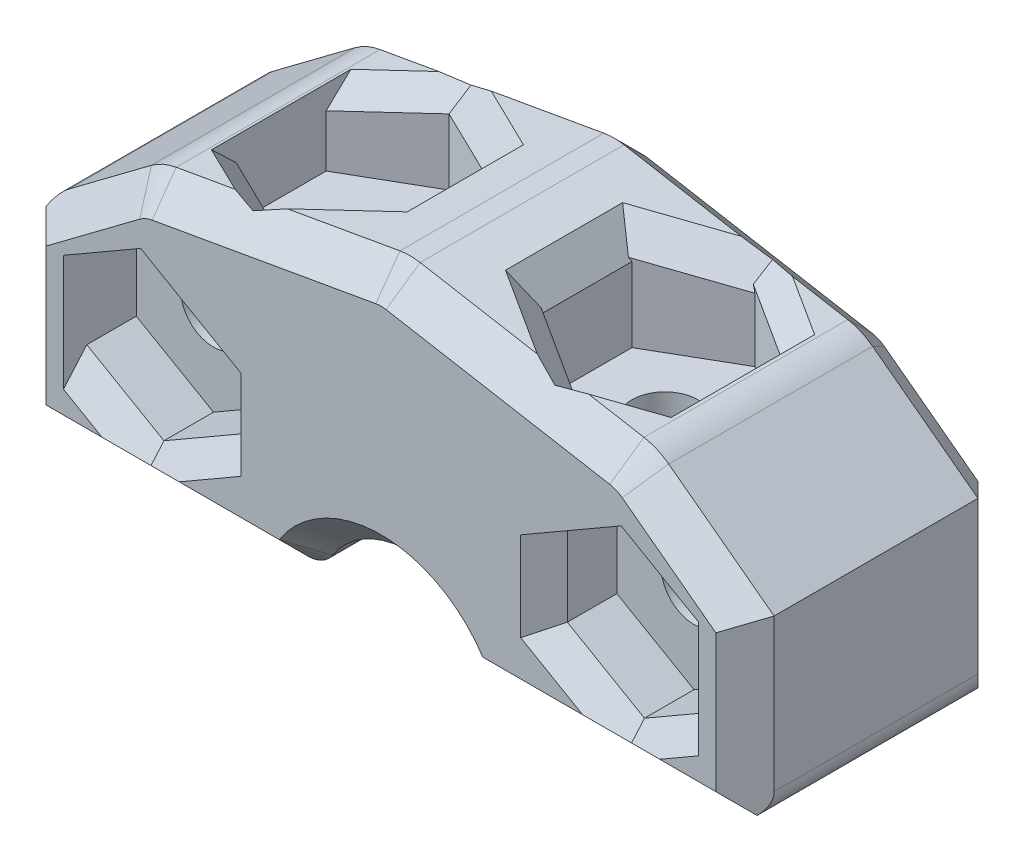
from build123d import *

# Parameters (mm, degrees)
BOSS_EXTRUDE1_DEPTH     = 9
CUT_EXTRUDE1_DEPTH      = 20.52562419
CUT_EXTRUDE1_DEPTH_BACK = 20.52562419
CHAMFER1_SIZE           = 1
CUT_EXTRUDE6_DEPTH      = 20.52562419
CUT_EXTRUDE6_DEPTH_BACK = 20.52562419
SKETCH8_W               = 25
SKETCH8_H               = 1.280441735
FILLET3_R               = 1
SKETCH4_R               = 1.125
CUT_EXTRUDE2_DEPTH      = 19.765898044
CUT_EXTRUDE3_START      = 8
CUT_EXTRUDE3_DEPTH      = 8
FILLET2_R               = 2
CHAMFER2_SIZE           = 1
SKETCH6_R               = 1.125
CUT_EXTRUDE4_DEPTH      = 20.506647196
CUT_EXTRUDE5_DEPTH      = 2.5
CHAMFER3_SIZE           = 0.8
CHAMFER3_SIZE_2         = 0.986438657
CHAMFER3_SIZE_3         = 0.879773446
CHAMFER3_SIZE_4         = 0.73861357
CHAMFER4_SIZE           = 1
CHAMFER5_SIZE           = 1


with BuildPart() as part:
    # Sketch1 → Boss-Extrude1 (new body)
    with BuildSketch(Plane.XY):
        with BuildLine():
            Line((-3.175, 0), (-12.5, 0))
            Line((-12.5, 0), (-12.5, 12))
            Line((-12.5, 12), (12.5, 12))
            Line((12.5, 12), (12.5, 0))
            Line((12.5, 0), (3.175, 0))
            ThreePointArc((3.175, 0), (0, 3.175), (-3.175, 0))
        make_face()
    extrude(amount=BOSS_EXTRUDE1_DEPTH)

    # Sketch2 → Cut-Extrude1 (cut, two sides: drawn at the far end of the back side and taken through both)
    with BuildSketch(Plane.XY.offset(9).offset(-CUT_EXTRUDE1_DEPTH_BACK)):
        Polygon((-8.5, 10.5), (0, 12), (-12.5, 12), (-12.5, 7.504439372), align=None)
        Polygon((12.5, 12), (0, 12), (8.5, 10.5), (12.5, 7.504439372), align=None)
    extrude(amount=CUT_EXTRUDE1_DEPTH + CUT_EXTRUDE1_DEPTH_BACK, mode=Mode.SUBTRACT)

    # Chamfer1
    chamfer1_edges = [part.edges().sort_by_distance(p)[0] for p in [
        (12.5, 3.752219686, 9),
        (-12.5, 3.752219686, 0),
        (-12.5, 3.752219686, 9),
        (12.5, 3.752219686, 0),
    ]]
    chamfer(chamfer1_edges, length=CHAMFER1_SIZE)

    # Sketch8 → Cut-Extrude6 (cut, two sides: drawn at the far end of the back side and taken through both)
    with BuildSketch(Plane(origin=(0, 0, 0), x_dir=(-1, 0, 0), z_dir=(0, 0, -1)).offset(-CUT_EXTRUDE6_DEPTH_BACK)):
        with Locations((0, 0.640220868)):
            Rectangle(SKETCH8_W, SKETCH8_H)
    extrude(amount=CUT_EXTRUDE6_DEPTH + CUT_EXTRUDE6_DEPTH_BACK, mode=Mode.SUBTRACT)

    # Fillet3
    fillet3_edges = [part.edges().sort_by_distance(p)[0] for p in [
        (-12.5, 1.280441735, 4.5),
        (2.905356082, 1.280441735, 4.5),
        (-2.905356082, 1.280441735, 4.5),
        (12.5, 1.280441735, 4.5),
    ]]
    fillet(fillet3_edges, radius=FILLET3_R)

    # Sketch4 → Cut-Extrude2 (cut, through all)
    with BuildSketch(Plane.XZ.offset(-1.280441735)):
        with Locations(Location((-5.25, 4.5, 0), (0, 0, 270))):
            Circle(SKETCH4_R)
        with Locations(Location((5.25, 4.5, 0), (0, 0, 270))):
            Circle(SKETCH4_R)
    extrude(amount=-CUT_EXTRUDE2_DEPTH, mode=Mode.SUBTRACT)

    # Sketch5 → Cut-Extrude3 (cut)
    with BuildSketch(Plane(origin=(0, 0, 0), x_dir=(1, 0, 0), z_dir=(0, 1, 0)).offset(CUT_EXTRUDE3_START)):
        Polygon((-5.25, -7.58882394), (-2.575, -6.04441197), (-2.575, -2.95558803), (-5.25, -1.41117606), (-7.925, -2.95558803), (-7.925, -6.04441197), align=None)
        Polygon((5.25, -7.58882394), (7.925, -6.04441197), (7.925, -2.95558803), (5.25, -1.41117606), (2.575, -2.95558803), (2.575, -6.04441197), align=None)
    extrude(amount=CUT_EXTRUDE3_DEPTH, mode=Mode.SUBTRACT)

    # Fillet2
    fillet2_edges = [part.edges().sort_by_distance(p)[0] for p in [
        (-8.5, 10.5, 4.5),
        (0, 12, 4.5),
        (8.5, 10.5, 4.5),
        (-12.5, 7.504439372, 4.5),
    ]]
    fillet(fillet2_edges, radius=FILLET2_R)

    # Chamfer2
    chamfer2_edges = [part.edges().sort_by_distance(p)[0] for p in [
        (-7.498585893, 1.280441735, 9),
        (-3.020838703, 1.401176818, 9),
        (0, 3.175, 9),
        (3.020838703, 1.401176818, 9),
        (7.498585893, 1.280441735, 9),
    ]]
    chamfer(chamfer2_edges, length=CHAMFER2_SIZE)
    # the kernel refuses this chamfer: 1 mm, written as the material it takes off along each edge
    with BuildSketch(Plane(origin=(-13.558442454, 6.711782236, 9), x_dir=(0.5992046713039103, -0.8001235771160529, 0.027495876610585623), z_dir=(0.8004262047278154, 0.5994313061436025, 0)), Plane(origin=(8.881689813, 10.214156256, 9), x_dir=(-0.59920467130391, -0.8001235771160532, 0.027495876610585623), z_dir=(0.8004262047278157, -0.5994313061436022, 0))) as chamfer2_2_piece_1:
        with BuildLine():
            Line((1.028673195, 0), (-0.056547155, 1.027117794))
            Line((-0.056547155, 1.027117794), (-0.076539593, 1.026567876))
            ThreePointArc((-0.076539593, 1.026567876), (-0.034129227, 0.51339783), (-0.019992438, -0.000549918))
            Line((-0.019992438, -0.000549918), (0.000549918, -0.019992438))
            ThreePointArc((0.000549918, -0.019992438), (0.514497665, -0.00585565), (1.029223113, -0.019992438))
            Line((1.029223113, -0.019992438), (1.028673195, 0))
        make_face()
    extrude(amount=5.842828, mode=Mode.SUBTRACT)
    with BuildSketch(Plane(origin=(-7.6828272, 8.613303847, 9), x_dir=(-0.5994313061436031, 0.8004262047278151, 0), z_dir=(-0.8004262047278151, -0.5994313061436031, 0))) as chamfer2_2_piece_2:
        with BuildLine():
            Line((0.971715729, -0.028284271), (2.028284271, 1.028284271))
            Line((2.028284271, 1.028284271), (2.048284271, 1.028284271))
            ThreePointArc((2.048284271, 1.028284271), (2.02, 0.514142136), (2.02, 0))
            Line((2.02, 0), (2, -0.02))
            ThreePointArc((2, -0.02), (1.485857864, -0.02), (0.971715729, -0.048284271))
            Line((0.971715729, -0.048284271), (0.971715729, -0.028284271))
        make_face()
    revolve(axis=Axis((-7.6828272, 8.613303847, 9), (0, 0, -1)), revolution_arc=26.821198995, mode=Mode.SUBTRACT)
    with BuildSketch(Plane(origin=(-8.030397868, 10.582870964, 9), x_dir=(0.173719628613232, -0.9844112288083147, 0.027495876610585654), z_dir=(0.9847835588179369, 0.17378533390904768, 0)), Plane(origin=(0.347570668, 11.938664, 9), x_dir=(-0.17371962861323179, -0.9844112288083147, 0.027495876610585654), z_dir=(0.9847835588179369, -0.17378533390904746, 0))) as chamfer2_2_piece_3:
        with BuildLine():
            Line((1.028673195, 0), (-0.056547155, 1.027117794))
            Line((-0.056547155, 1.027117794), (-0.076539593, 1.026567876))
            ThreePointArc((-0.076539593, 1.026567876), (-0.034129227, 0.51339783), (-0.019992438, -0.000549918))
            Line((-0.019992438, -0.000549918), (0.000549918, -0.019992438))
            ThreePointArc((0.000549918, -0.019992438), (0.514497665, -0.00585565), (1.029223113, -0.019992438))
            Line((1.029223113, -0.019992438), (1.028673195, 0))
        make_face()
    extrude(amount=7.801538858, mode=Mode.SUBTRACT)
    with BuildSketch(Plane(origin=(0, 9.969096882, 9), x_dir=(-0.17378533390904846, 0.9847835588179368, 0), z_dir=(-0.9847835588179368, -0.17378533390904846, 0))) as chamfer2_2_piece_4:
        with BuildLine():
            Line((0.971715729, -0.028284271), (2.028284271, 1.028284271))
            Line((2.028284271, 1.028284271), (2.048284271, 1.028284271))
            ThreePointArc((2.048284271, 1.028284271), (2.02, 0.514142136), (2.02, 0))
            Line((2.02, 0), (2, -0.02))
            ThreePointArc((2, -0.02), (1.485857864, -0.02), (0.971715729, -0.048284271))
            Line((0.971715729, -0.048284271), (0.971715729, -0.028284271))
        make_face()
    revolve(axis=Axis((0, 9.969096882, 9), (0, 0, -1)), revolution_arc=20.015959603, mode=Mode.SUBTRACT)
    with BuildSketch(Plane(origin=(7.6828272, 8.613303847, 9), x_dir=(0.17378533390904757, 0.9847835588179368, 0), z_dir=(-0.9847835588179368, 0.17378533390904757, 0))) as chamfer2_2_piece_5:
        with BuildLine():
            Line((0.971715729, -0.028284271), (2.028284271, 1.028284271))
            Line((2.028284271, 1.028284271), (2.048284271, 1.028284271))
            ThreePointArc((2.048284271, 1.028284271), (2.02, 0.514142136), (2.02, 0))
            Line((2.02, 0), (2, -0.02))
            ThreePointArc((2, -0.02), (1.485857864, -0.02), (0.971715729, -0.048284271))
            Line((0.971715729, -0.048284271), (0.971715729, -0.028284271))
        make_face()
    revolve(axis=Axis((7.6828272, 8.613303847, 9), (0, 0, -1)), revolution_arc=26.821198995, mode=Mode.SUBTRACT)

    # Sketch6 → Cut-Extrude4 (cut, through all)
    with BuildSketch(Plane.XY.offset(9)):
        with Locations((-8.25, 5.5)):
            Circle(SKETCH6_R)
        with Locations((8.25, 5.5)):
            Circle(SKETCH6_R)
    extrude(amount=-CUT_EXTRUDE4_DEPTH, mode=Mode.SUBTRACT)

    # Sketch7 → Cut-Extrude5 (cut)
    with BuildSketch(Plane.XY.offset(9)):
        Polygon((-8.25, 2.440043573), (-5.6, 3.970021787), (-5.6, 7.029978213), (-8.25, 8.559956427), (-10.9, 7.029978213), (-10.9, 3.970021787), align=None)
        Polygon((8.25, 2.440043573), (10.9, 3.970021787), (10.9, 7.029978213), (8.25, 8.559956427), (5.6, 7.029978213), (5.6, 3.970021787), align=None)
    extrude(amount=-CUT_EXTRUDE5_DEPTH, mode=Mode.SUBTRACT)

    # Chamfer3
    # the kernel refuses this chamfer: 0.986438657, 0.879773446, 0.8, 0.73861357 mm, written as the material it takes off along each edge
    with BuildSketch(Plane(origin=(2.575, 11.545588235, 8.591948952), x_dir=(-0.9783714762369112, 0.20685563682434935, 0), z_dir=(0, 0, -1))) as chamfer3_piece_1_section:
        Polygon((CHAMFER3_SIZE * 0.999432620131, -CHAMFER3_SIZE * 0.0336814165085), (-CHAMFER3_SIZE_2 * 0.206855636874, -CHAMFER3_SIZE_2 * 0.978371476471), (0, 0), align=None)
    chamfer3_piece_1 = extrude(amount=8.183897904, mode=Mode.PRIVATE)
    chamfer3_piece_1 = split(chamfer3_piece_1, bisect_by=Plane(origin=(1.725667203, 11.250261997, 3.445950549), z_dir=(0.5000000000000002, 0, 0.8660254037844386)), keep=Keep.TOP, mode=Mode.PRIVATE)
    chamfer3_piece_1 = split(chamfer3_piece_1, bisect_by=Plane(origin=(1.725667203, 11.250261997, 5.554049451), z_dir=(0.4999999999999991, 0, -0.8660254037844392)), keep=Keep.TOP, mode=Mode.PRIVATE)
    add(chamfer3_piece_1, mode=Mode.SUBTRACT)
    with BuildSketch(Plane(origin=(-2.575, 11.545588235, 0.408051048), x_dir=(0.9806818086984711, 0.19560979036821113, 0), z_dir=(0, 0, 1))) as chamfer3_piece_2_section:
        Polygon((CHAMFER3_SIZE_2 * 0.999753434612, -CHAMFER3_SIZE_2 * 0.0222051899206), (-CHAMFER3_SIZE * 0.195609790368, -CHAMFER3_SIZE * 0.980681808698), (0, 0), align=None)
    chamfer3_piece_2 = extrude(amount=8.183897904, mode=Mode.PRIVATE)
    chamfer3_piece_2 = split(chamfer3_piece_2, bisect_by=Plane(origin=(-1.684184287, 11.325273908, 3.469900721), z_dir=(-0.49999999999999983, 0, 0.8660254037844388)), keep=Keep.TOP, mode=Mode.PRIVATE)
    chamfer3_piece_2 = split(chamfer3_piece_2, bisect_by=Plane(origin=(-1.684184287, 11.325273908, 5.530099279), z_dir=(-0.4999999999999994, 0, -0.866025403784439)), keep=Keep.TOP, mode=Mode.PRIVATE)
    add(chamfer3_piece_2, mode=Mode.SUBTRACT)
    with BuildSketch(Plane(origin=(-12.681714238, 4.998694982, 9), x_dir=(-0.49981095845564805, -0.8656979742248805, 0.02749587661058733), z_dir=(0.8660254037844388, -0.4999999999999997, 0))) as chamfer3_piece_3_section:
        Polygon((CHAMFER3_SIZE * 0.999621916911, CHAMFER3_SIZE * 0.0274958766106), (-CHAMFER3_SIZE * 0.0274958766106, CHAMFER3_SIZE * 0.999621916911), (0, 0), align=None)
    chamfer3_piece_3 = extrude(amount=7.174649207, mode=Mode.PRIVATE)
    chamfer3_piece_3 = split(chamfer3_piece_3, bisect_by=Plane(origin=(-10.9, 2.991295266, 8.727059614), z_dir=(1, 0, 0)), keep=Keep.TOP, mode=Mode.PRIVATE)
    chamfer3_piece_3 = split(chamfer3_piece_3, bisect_by=Plane(origin=(-9.09760203, 1.950680313, 8.727059614), z_dir=(-0.5000000000000011, 0.866025403784438, 0)), keep=Keep.TOP, mode=Mode.PRIVATE)
    add(chamfer3_piece_3, mode=Mode.SUBTRACT)
    with BuildSketch(Plane(origin=(-10.031714238, 1.411370378, 9), x_dir=(0.49981095845564943, -0.8656979742248796, 0.02749587661058734), z_dir=(0.866025403784438, 0.5000000000000011, 0))) as chamfer3_piece_4_section:
        Polygon((CHAMFER3_SIZE * 0.999621916911, CHAMFER3_SIZE * 0.0274958766106), (-CHAMFER3_SIZE * 0.0274958766106, CHAMFER3_SIZE * 0.999621916911), (0, 0), align=None)
    chamfer3_piece_4 = extrude(amount=7.174649207, mode=Mode.PRIVATE)
    chamfer3_piece_4 = split(chamfer3_piece_4, bisect_by=Plane(origin=(-7.40239797, 1.950680313, 8.727059614), z_dir=(0.4999999999999997, 0.8660254037844388, 0)), keep=Keep.TOP, mode=Mode.PRIVATE)
    chamfer3_piece_4 = split(chamfer3_piece_4, bisect_by=Plane(origin=(-5.6, 2.991295266, 8.727059614), z_dir=(-1, 0, 0)), keep=Keep.TOP, mode=Mode.PRIVATE)
    add(chamfer3_piece_4, mode=Mode.SUBTRACT)
    with BuildSketch(Plane(origin=(-5.6, 1.912675396, 9), x_dir=(0.9996219169112966, 3.4817853223456008e-15, 0.02749587661058736), z_dir=(0, 1, 0))) as chamfer3_piece_5_section:
        Polygon((CHAMFER3_SIZE * 0.999621916911, CHAMFER3_SIZE * 0.0274958766106), (-CHAMFER3_SIZE * 0.0274958766106, CHAMFER3_SIZE * 0.999621916911), (0, 0), align=None)
    chamfer3_piece_5 = extrude(amount=7.174649207, mode=Mode.PRIVATE)
    chamfer3_piece_5 = split(chamfer3_piece_5, bisect_by=Plane(origin=(-4.75239797, 6.540614953, 8.727059614), z_dir=(-0.5000000000000006, -0.8660254037844384, 0)), keep=Keep.TOP, mode=Mode.PRIVATE)
    chamfer3_piece_5 = split(chamfer3_piece_5, bisect_by=Plane(origin=(-4.75239797, 4.459385047, 8.727059614), z_dir=(-0.5000000000000011, 0.866025403784438, 0)), keep=Keep.TOP, mode=Mode.PRIVATE)
    add(chamfer3_piece_5, mode=Mode.SUBTRACT)
    with BuildSketch(Plane(origin=(3.818285762, 4.998694982, 9), x_dir=(-0.49981095845564866, -0.8656979742248802, 0.027495876610587364), z_dir=(0.8660254037844386, -0.5000000000000003, 0))) as chamfer3_piece_6_section:
        Polygon((CHAMFER3_SIZE * 0.999621916911, CHAMFER3_SIZE * 0.0274958766106), (-CHAMFER3_SIZE * 0.0274958766106, CHAMFER3_SIZE * 0.999621916911), (0, 0), align=None)
    chamfer3_piece_6 = extrude(amount=7.174649207, mode=Mode.PRIVATE)
    chamfer3_piece_6 = split(chamfer3_piece_6, bisect_by=Plane(origin=(5.6, 2.991295266, 8.727059614), z_dir=(1, 0, 0)), keep=Keep.TOP, mode=Mode.PRIVATE)
    chamfer3_piece_6 = split(chamfer3_piece_6, bisect_by=Plane(origin=(7.40239797, 1.950680313, 8.727059614), z_dir=(-0.5000000000000017, 0.8660254037844377, 0)), keep=Keep.TOP, mode=Mode.PRIVATE)
    add(chamfer3_piece_6, mode=Mode.SUBTRACT)
    with BuildSketch(Plane(origin=(6.468285762, 1.411370378, 9), x_dir=(0.49981095845565005, -0.8656979742248794, 0.02749587661058733), z_dir=(0.8660254037844377, 0.5000000000000017, 0))) as chamfer3_piece_7_section:
        Polygon((CHAMFER3_SIZE * 0.999621916911, CHAMFER3_SIZE * 0.0274958766106), (-CHAMFER3_SIZE * 0.0274958766106, CHAMFER3_SIZE * 0.999621916911), (0, 0), align=None)
    chamfer3_piece_7 = extrude(amount=7.174649207, mode=Mode.PRIVATE)
    chamfer3_piece_7 = split(chamfer3_piece_7, bisect_by=Plane(origin=(9.09760203, 1.950680313, 8.727059614), z_dir=(0.5000000000000003, 0.8660254037844387, 0)), keep=Keep.TOP, mode=Mode.PRIVATE)
    chamfer3_piece_7 = split(chamfer3_piece_7, bisect_by=Plane(origin=(10.9, 2.991295266, 8.727059614), z_dir=(-1, 0, 0)), keep=Keep.TOP, mode=Mode.PRIVATE)
    add(chamfer3_piece_7, mode=Mode.SUBTRACT)
    with BuildSketch(Plane(origin=(5.6, 9.087324604, 9), x_dir=(-0.9996219169112966, 0, 0.02749587661058736), z_dir=(0, -1, 0))) as chamfer3_piece_8_section:
        Polygon((CHAMFER3_SIZE * 0.999621916911, CHAMFER3_SIZE * 0.0274958766106), (-CHAMFER3_SIZE * 0.0274958766106, CHAMFER3_SIZE * 0.999621916911), (0, 0), align=None)
    chamfer3_piece_8 = extrude(amount=7.174649207, mode=Mode.PRIVATE)
    chamfer3_piece_8 = split(chamfer3_piece_8, bisect_by=Plane(origin=(4.75239797, 4.459385047, 8.727059614), z_dir=(0.5000000000000003, 0.8660254037844387, 0)), keep=Keep.TOP, mode=Mode.PRIVATE)
    chamfer3_piece_8 = split(chamfer3_piece_8, bisect_by=Plane(origin=(4.75239797, 6.540614953, 8.727059614), z_dir=(0.5000000000000002, -0.8660254037844386, 0)), keep=Keep.TOP, mode=Mode.PRIVATE)
    add(chamfer3_piece_8, mode=Mode.SUBTRACT)
    with BuildSketch(Plane(origin=(-12.681714238, 4.998694982, 9), x_dir=(-0.49981095845564805, -0.8656979742248805, 0.02749587661058733), z_dir=(0.8660254037844388, -0.4999999999999997, 0))) as chamfer3_piece_9a_section:
        Polygon((CHAMFER3_SIZE * 0.999621916911, CHAMFER3_SIZE * 0.0274958766106), (-CHAMFER3_SIZE * 0.0274958766106, CHAMFER3_SIZE * 0.999621916911), (0, 0), align=None)
    chamfer3_piece_9a = extrude(amount=7.174649207, mode=Mode.PRIVATE)
    chamfer3_piece_9a = split(chamfer3_piece_9a, bisect_by=Plane(origin=(-8.044718585, 2.558562853, 8.74184205), z_dir=(0.5000000000000011, -0.866025403784438, 0)), keep=Keep.TOP, mode=Mode.PRIVATE)
    with BuildSketch(Plane(origin=(-10.031714238, 1.411370378, 9), x_dir=(0.49981095845564943, -0.8656979742248796, 0.02749587661058734), z_dir=(0.866025403784438, 0.5000000000000011, 0))) as chamfer3_piece_9b_section:
        Polygon((CHAMFER3_SIZE * 0.999621916911, CHAMFER3_SIZE * 0.0274958766106), (-CHAMFER3_SIZE * 0.0274958766106, CHAMFER3_SIZE * 0.999621916911), (0, 0), align=None)
    chamfer3_piece_9b = extrude(amount=7.174649207, mode=Mode.PRIVATE)
    chamfer3_piece_9b = split(chamfer3_piece_9b, bisect_by=Plane(origin=(-8.455281415, 2.558562853, 8.74184205), z_dir=(-0.4999999999999997, -0.8660254037844388, 0)), keep=Keep.TOP, mode=Mode.PRIVATE)
    chamfer3_piece_9 = chamfer3_piece_9a & chamfer3_piece_9b
    add(chamfer3_piece_9, mode=Mode.SUBTRACT)
    with BuildSketch(Plane(origin=(-5.6, 1.912675396, 9), x_dir=(0.9996219169112966, 3.4817853223456008e-15, 0.02749587661058736), z_dir=(0, 1, 0))) as chamfer3_piece_10a_section:
        Polygon((CHAMFER3_SIZE * 0.999621916911, CHAMFER3_SIZE * 0.0274958766106), (-CHAMFER3_SIZE * 0.0274958766106, CHAMFER3_SIZE * 0.999621916911), (0, 0), align=None)
    chamfer3_piece_10a = extrude(amount=7.174649207, mode=Mode.PRIVATE)
    chamfer3_piece_10a = split(chamfer3_piece_10a, bisect_by=Plane(origin=(-5.805281415, 3.851502507, 8.74184205), z_dir=(0.5000000000000011, -0.866025403784438, 0)), keep=Keep.TOP, mode=Mode.PRIVATE)
    with BuildSketch(Plane(origin=(-10.031714238, 1.411370378, 9), x_dir=(0.49981095845564943, -0.8656979742248796, 0.02749587661058734), z_dir=(0.866025403784438, 0.5000000000000011, 0))) as chamfer3_piece_10b_section:
        Polygon((CHAMFER3_SIZE * 0.999621916911, CHAMFER3_SIZE * 0.0274958766106), (-CHAMFER3_SIZE * 0.0274958766106, CHAMFER3_SIZE * 0.999621916911), (0, 0), align=None)
    chamfer3_piece_10b = extrude(amount=7.174649207, mode=Mode.PRIVATE)
    chamfer3_piece_10b = split(chamfer3_piece_10b, bisect_by=Plane(origin=(-5.6, 4.207060347, 8.74184205), z_dir=(1, 0, 0)), keep=Keep.TOP, mode=Mode.PRIVATE)
    chamfer3_piece_10 = chamfer3_piece_10a & chamfer3_piece_10b
    add(chamfer3_piece_10, mode=Mode.SUBTRACT)
    with BuildSketch(Plane(origin=(3.818285762, 4.998694982, 9), x_dir=(-0.49981095845564866, -0.8656979742248802, 0.027495876610587364), z_dir=(0.8660254037844386, -0.5000000000000003, 0))) as chamfer3_piece_11a_section:
        Polygon((CHAMFER3_SIZE * 0.999621916911, CHAMFER3_SIZE * 0.0274958766106), (-CHAMFER3_SIZE * 0.0274958766106, CHAMFER3_SIZE * 0.999621916911), (0, 0), align=None)
    chamfer3_piece_11a = extrude(amount=7.174649207, mode=Mode.PRIVATE)
    chamfer3_piece_11a = split(chamfer3_piece_11a, bisect_by=Plane(origin=(5.6, 4.207060347, 8.74184205), z_dir=(-1, 0, 0)), keep=Keep.TOP, mode=Mode.PRIVATE)
    with BuildSketch(Plane(origin=(5.6, 9.087324604, 9), x_dir=(-0.9996219169112966, 0, 0.02749587661058736), z_dir=(0, -1, 0))) as chamfer3_piece_11b_section:
        Polygon((CHAMFER3_SIZE * 0.999621916911, CHAMFER3_SIZE * 0.0274958766106), (-CHAMFER3_SIZE * 0.0274958766106, CHAMFER3_SIZE * 0.999621916911), (0, 0), align=None)
    chamfer3_piece_11b = extrude(amount=7.174649207, mode=Mode.PRIVATE)
    chamfer3_piece_11b = split(chamfer3_piece_11b, bisect_by=Plane(origin=(5.805281415, 3.851502507, 8.74184205), z_dir=(-0.5000000000000003, -0.8660254037844387, 0)), keep=Keep.TOP, mode=Mode.PRIVATE)
    chamfer3_piece_11 = chamfer3_piece_11a & chamfer3_piece_11b
    add(chamfer3_piece_11, mode=Mode.SUBTRACT)
    with BuildSketch(Plane(origin=(3.818285762, 4.998694982, 9), x_dir=(-0.49981095845564866, -0.8656979742248802, 0.027495876610587364), z_dir=(0.8660254037844386, -0.5000000000000003, 0))) as chamfer3_piece_12a_section:
        Polygon((CHAMFER3_SIZE * 0.999621916911, CHAMFER3_SIZE * 0.0274958766106), (-CHAMFER3_SIZE * 0.0274958766106, CHAMFER3_SIZE * 0.999621916911), (0, 0), align=None)
    chamfer3_piece_12a = extrude(amount=7.174649207, mode=Mode.PRIVATE)
    chamfer3_piece_12a = split(chamfer3_piece_12a, bisect_by=Plane(origin=(8.455281415, 2.558562853, 8.74184205), z_dir=(0.5000000000000017, -0.8660254037844377, 0)), keep=Keep.TOP, mode=Mode.PRIVATE)
    with BuildSketch(Plane(origin=(6.468285762, 1.411370378, 9), x_dir=(0.49981095845565005, -0.8656979742248794, 0.02749587661058733), z_dir=(0.8660254037844377, 0.5000000000000017, 0))) as chamfer3_piece_12b_section:
        Polygon((CHAMFER3_SIZE * 0.999621916911, CHAMFER3_SIZE * 0.0274958766106), (-CHAMFER3_SIZE * 0.0274958766106, CHAMFER3_SIZE * 0.999621916911), (0, 0), align=None)
    chamfer3_piece_12b = extrude(amount=7.174649207, mode=Mode.PRIVATE)
    chamfer3_piece_12b = split(chamfer3_piece_12b, bisect_by=Plane(origin=(8.044718585, 2.558562853, 8.74184205), z_dir=(-0.5000000000000003, -0.8660254037844387, 0)), keep=Keep.TOP, mode=Mode.PRIVATE)
    chamfer3_piece_12 = chamfer3_piece_12a & chamfer3_piece_12b
    add(chamfer3_piece_12, mode=Mode.SUBTRACT)
    # the kernel refuses this chamfer: 0.986438657, 0.879773446, 0.8, 0.73861357 mm, written as the material it takes off along each edge
    with BuildSketch(Plane(origin=(-0.154017109, 12.02717949, 4.531186793), x_dir=(-0.11831947151901516, -0.9882148070024793, 0.097118473425572), z_dir=(0.8560855693873548, -0.15107392400953276, -0.4942612339351433))) as chamfer3_2_piece_1_section:
        Polygon((CHAMFER3_SIZE_3 * 0.999688767455, CHAMFER3_SIZE_3 * 0.0249473294165), (-CHAMFER3_SIZE * 0.111718593686, CHAMFER3_SIZE * 0.993739883382), (0, 0), align=None)
    chamfer3_2_piece_1 = extrude(amount=8.579992041, mode=Mode.PRIVATE)
    chamfer3_2_piece_1 = split(chamfer3_2_piece_1, bisect_by=Plane(origin=(4.250974728, 11.092560016, 0.83438855), z_dir=(-0.4999999999999992, 0, 0.8660254037844392)), keep=Keep.TOP, mode=Mode.PRIVATE)
    chamfer3_2_piece_1 = split(chamfer3_2_piece_1, bisect_by=Plane(origin=(2.630752607, 10.479502997, 2.123772863), z_dir=(0.819231920519041, 0.5734623443633275, 0)), keep=Keep.TOP, mode=Mode.PRIVATE)
    add(chamfer3_2_piece_1, mode=Mode.SUBTRACT)
    with BuildSketch(Plane(origin=(7.191190262, 10.730966424, 8.709570661), x_dir=(-0.11831947151901531, -0.9882148070024793, -0.09711847342557245), z_dir=(-0.8560855693873552, 0.1510739240095331, -0.49426123393514243))) as chamfer3_2_piece_2_section:
        Polygon((CHAMFER3_SIZE_3 * 0.999688767455, CHAMFER3_SIZE_3 * 0.0249473294165), (-CHAMFER3_SIZE * 0.111718593686, CHAMFER3_SIZE * 0.993739883382), (0, 0), align=None)
    chamfer3_2_piece_2 = extrude(amount=8.579992041, mode=Mode.PRIVATE)
    chamfer3_2_piece_2 = split(chamfer3_2_piece_2, bisect_by=Plane(origin=(2.630752607, 10.479502997, 6.876227137), z_dir=(0.819231920519041, 0.5734623443633275, 0)), keep=Keep.TOP, mode=Mode.PRIVATE)
    chamfer3_2_piece_2 = split(chamfer3_2_piece_2, bisect_by=Plane(origin=(4.250974728, 11.092560016, 8.16561145), z_dir=(-0.5000000000000003, 0, -0.8660254037844385)), keep=Keep.TOP, mode=Mode.PRIVATE)
    add(chamfer3_2_piece_2, mode=Mode.SUBTRACT)
    with BuildSketch(Plane(origin=(-7.191190262, 10.730966424, 0.290429339), x_dir=(0.48225336728766227, 0.1104363399376741, -0.8690428669294061), z_dir=(0.8560855693873548, 0.15107392400953326, 0.49426123393514315))) as chamfer3_2_piece_3_section:
        Polygon((CHAMFER3_SIZE_3 * 0.999688767455, -CHAMFER3_SIZE_3 * 0.0249473294165), (-CHAMFER3_SIZE * 0.111718593686, -CHAMFER3_SIZE * 0.993739883382), (0, 0), align=None)
    chamfer3_2_piece_3 = extrude(amount=8.794458598, mode=Mode.PRIVATE)
    chamfer3_2_piece_3 = split(chamfer3_2_piece_3, bisect_by=Plane(origin=(-4.379450603, 11.057382076, 0.908564131), z_dir=(0.49999999999999956, 0, 0.8660254037844389)), keep=Keep.TOP, mode=Mode.PRIVATE)
    chamfer3_2_piece_3 = split(chamfer3_2_piece_3, bisect_by=Plane(origin=(-2.575, 11.057382076, 1.950335341), z_dir=(-1, 0, 0)), keep=Keep.TOP, mode=Mode.PRIVATE)
    chamfer3_2_piece_3 = split(chamfer3_2_piece_3, bisect_by=Plane(origin=(-3.020594937, 10.299993299, 1.950335341), z_dir=(-0.7071067811865465, 0.7071067811865486, 0)), keep=Keep.TOP, mode=Mode.PRIVATE)
    add(chamfer3_2_piece_3, mode=Mode.SUBTRACT)
    with BuildSketch(Plane(origin=(-7.191190262, 10.730966424, 0.290429339), x_dir=(0.48225336728766227, 0.1104363399376741, -0.8690428669294061), z_dir=(0.8560855693873548, 0.15107392400953326, 0.49426123393514315))) as chamfer3_2_piece_4_section:
        Polygon((CHAMFER3_SIZE_3 * 0.999688767455, -CHAMFER3_SIZE_3 * 0.0249473294165), (-CHAMFER3_SIZE * 0.111718593686, -CHAMFER3_SIZE * 0.993739883382), (0, 0), align=None)
    chamfer3_2_piece_4 = extrude(amount=8.794458598, mode=Mode.PRIVATE)
    chamfer3_2_piece_4 = split(chamfer3_2_piece_4, bisect_by=Plane(origin=(-2.575, 10.72442666, 2.978847911), z_dir=(-1, 0, 0)), keep=Keep.TOP, mode=Mode.PRIVATE)
    chamfer3_2_piece_4 = split(chamfer3_2_piece_4, bisect_by=Plane(origin=(-2.591383155, 10.72920508, 2.978847911), z_dir=(0.7071067811865465, -0.7071067811865486, 0)), keep=Keep.TOP, mode=Mode.PRIVATE)
    add(chamfer3_2_piece_4, mode=Mode.SUBTRACT)
    with BuildSketch(Plane(origin=(-7.191190262, 10.730966424, 0.290429339), x_dir=(0.48225336728766227, 0.1104363399376741, -0.8690428669294061), z_dir=(0.8560855693873548, 0.15107392400953326, 0.49426123393514315))) as chamfer3_2_piece_5_section:
        Polygon((CHAMFER3_SIZE_3 * 0.999688767455, -CHAMFER3_SIZE_3 * 0.0249473294165), (-CHAMFER3_SIZE * 0.111718593686, -CHAMFER3_SIZE * 0.993739883382), (0, 0), align=None)
    chamfer3_2_piece_5 = extrude(amount=8.794458598, mode=Mode.PRIVATE)
    chamfer3_2_piece_5 = split(chamfer3_2_piece_5, bisect_by=Plane(origin=(-2.575, 11.423550312, 2.78359327), z_dir=(1, 0, 0)), keep=Keep.TOP, mode=Mode.PRIVATE)
    chamfer3_2_piece_5 = split(chamfer3_2_piece_5, bisect_by=Plane(origin=(-2.050126134, 11.270462101, 2.78359327), z_dir=(-0.7071067811865465, 0.7071067811865486, 0)), keep=Keep.TOP, mode=Mode.PRIVATE)
    add(chamfer3_2_piece_5, mode=Mode.SUBTRACT)
    with BuildSketch(Plane(origin=(0.337618834, 12.059579794, 4.362810702), x_dir=(0.48225336728766166, 0.110436339937674, 0.8690428669294065), z_dir=(-0.8560855693873551, -0.15107392400953346, 0.4942612339351425))) as chamfer3_2_piece_6_section:
        Polygon((CHAMFER3_SIZE_3 * 0.999688767455, -CHAMFER3_SIZE_3 * 0.0249473294165), (-CHAMFER3_SIZE * 0.111718593686, -CHAMFER3_SIZE * 0.993739883382), (0, 0), align=None)
    chamfer3_2_piece_6 = extrude(amount=8.794458598, mode=Mode.PRIVATE)
    chamfer3_2_piece_6 = split(chamfer3_2_piece_6, bisect_by=Plane(origin=(-2.575, 10.72442666, 6.021152089), z_dir=(-1, 0, 0)), keep=Keep.TOP, mode=Mode.PRIVATE)
    chamfer3_2_piece_6 = split(chamfer3_2_piece_6, bisect_by=Plane(origin=(-2.591383155, 10.72920508, 6.021152089), z_dir=(0.7071067811865465, -0.7071067811865486, 0)), keep=Keep.TOP, mode=Mode.PRIVATE)
    add(chamfer3_2_piece_6, mode=Mode.SUBTRACT)
    with BuildSketch(Plane(origin=(0.337618834, 12.059579794, 4.362810702), x_dir=(0.48225336728766166, 0.110436339937674, 0.8690428669294065), z_dir=(-0.8560855693873551, -0.15107392400953346, 0.4942612339351425))) as chamfer3_2_piece_7_section:
        Polygon((CHAMFER3_SIZE_3 * 0.999688767455, -CHAMFER3_SIZE_3 * 0.0249473294165), (-CHAMFER3_SIZE * 0.111718593686, -CHAMFER3_SIZE * 0.993739883382), (0, 0), align=None)
    chamfer3_2_piece_7 = extrude(amount=8.794458598, mode=Mode.PRIVATE)
    chamfer3_2_piece_7 = split(chamfer3_2_piece_7, bisect_by=Plane(origin=(-2.575, 11.423550312, 6.21640673), z_dir=(1, 0, 0)), keep=Keep.TOP, mode=Mode.PRIVATE)
    chamfer3_2_piece_7 = split(chamfer3_2_piece_7, bisect_by=Plane(origin=(-2.050126134, 11.270462101, 6.21640673), z_dir=(-0.7071067811865465, 0.7071067811865486, 0)), keep=Keep.TOP, mode=Mode.PRIVATE)
    add(chamfer3_2_piece_7, mode=Mode.SUBTRACT)
    with BuildSketch(Plane(origin=(0.337618834, 12.059579794, 4.362810702), x_dir=(0.48225336728766166, 0.110436339937674, 0.8690428669294065), z_dir=(-0.8560855693873551, -0.15107392400953346, 0.4942612339351425))) as chamfer3_2_piece_8_section:
        Polygon((CHAMFER3_SIZE_3 * 0.999688767455, -CHAMFER3_SIZE_3 * 0.0249473294165), (-CHAMFER3_SIZE * 0.111718593686, -CHAMFER3_SIZE * 0.993739883382), (0, 0), align=None)
    chamfer3_2_piece_8 = extrude(amount=8.794458598, mode=Mode.PRIVATE)
    chamfer3_2_piece_8 = split(chamfer3_2_piece_8, bisect_by=Plane(origin=(-2.575, 11.057382076, 7.049664659), z_dir=(-1, 0, 0)), keep=Keep.TOP, mode=Mode.PRIVATE)
    chamfer3_2_piece_8 = split(chamfer3_2_piece_8, bisect_by=Plane(origin=(-4.379450603, 11.057382076, 8.091435869), z_dir=(0.4999999999999999, 0, -0.8660254037844388)), keep=Keep.TOP, mode=Mode.PRIVATE)
    chamfer3_2_piece_8 = split(chamfer3_2_piece_8, bisect_by=Plane(origin=(-3.020594937, 10.299993299, 7.049664659), z_dir=(-0.7071067811865465, 0.7071067811865486, 0)), keep=Keep.TOP, mode=Mode.PRIVATE)
    add(chamfer3_2_piece_8, mode=Mode.SUBTRACT)
    # the kernel refuses this chamfer: 0.986438657, 0.879773446, 0.8, 0.73861357 mm, written as the material it takes off along each edge
    with BuildSketch(Plane(origin=(2.691761301, 11.5249833, -0.065823742), x_dir=(-0.1468982296851696, -0.9880077934945509, -0.04755533733864291), z_dir=(0.8560855693873552, -0.15107392400953337, 0.49426123393514243))) as chamfer3_3_piece_1_section:
        Polygon((CHAMFER3_SIZE_4 * 0.999479350462, CHAMFER3_SIZE_4 * 0.0322649846417), (CHAMFER3_SIZE * 0.0547044781734, CHAMFER3_SIZE * 0.998502588914), (0, 0), align=None)
    chamfer3_3_piece_1 = extrude(amount=8.170331922, mode=Mode.PRIVATE)
    chamfer3_3_piece_1 = split(chamfer3_3_piece_1, bisect_by=Plane(origin=(7.925, 10.624192055, 1.794123788), z_dir=(-1, 0, 0)), keep=Keep.TOP, mode=Mode.PRIVATE)
    chamfer3_3_piece_1 = split(chamfer3_3_piece_1, bisect_by=Plane(origin=(5.928188759, 9.947623477, 1.139815337), z_dir=(0.46706218100543484, 0.635609945453963, 0.6146974185031663)), keep=Keep.TOP, mode=Mode.PRIVATE)
    add(chamfer3_3_piece_1, mode=Mode.SUBTRACT)
    with BuildSketch(Plane(origin=(9.686264556, 10.290659196, 5.027545405), x_dir=(-0.14689822968516894, -0.988007793494551, 0.04755533733864299), z_dir=(-0.8560855693873544, 0.15107392400953273, 0.4942612339351442))) as chamfer3_3_piece_2_section:
        Polygon((CHAMFER3_SIZE_4 * 0.999479350462, CHAMFER3_SIZE_4 * 0.0322649846417), (CHAMFER3_SIZE * 0.0547044781734, CHAMFER3_SIZE * 0.998502588914), (0, 0), align=None)
    chamfer3_3_piece_2 = extrude(amount=8.071280706, mode=Mode.PRIVATE)
    chamfer3_3_piece_2 = split(chamfer3_3_piece_2, bisect_by=Plane(origin=(7.925, 10.624192055, 7.205876212), z_dir=(-1, 0, 0)), keep=Keep.TOP, mode=Mode.PRIVATE)
    chamfer3_3_piece_2 = split(chamfer3_3_piece_2, bisect_by=Plane(origin=(5.928188759, 9.947623477, 7.860184663), z_dir=(0.46706218100543445, 0.6356099454539631, -0.6146974185031666)), keep=Keep.TOP, mode=Mode.PRIVATE)
    add(chamfer3_3_piece_2, mode=Mode.SUBTRACT)
    with BuildSketch(Plane(origin=(-9.686264556, 10.290659196, 3.972454595), x_dir=(0.14453232827855017, -0.9881487242423816, -0.05169627511277), z_dir=(0.8560855693873551, 0.15107392400953354, -0.4942612339351427))) as chamfer3_3_piece_3_section:
        Polygon((CHAMFER3_SIZE * 0.999621916911, CHAMFER3_SIZE * 0.0274958766106), (CHAMFER3_SIZE_4 * 0.0594679359577, CHAMFER3_SIZE_4 * 0.998230216847), (0, 0), align=None)
    chamfer3_3_piece_3 = extrude(amount=8.263163434, mode=Mode.PRIVATE)
    chamfer3_3_piece_3 = split(chamfer3_3_piece_3, bisect_by=Plane(origin=(-7.925, 10.541411325, 1.986117551), z_dir=(1, 0, 0)), keep=Keep.TOP, mode=Mode.PRIVATE)
    chamfer3_3_piece_3 = split(chamfer3_3_piece_3, bisect_by=Plane(origin=(-6.08959937, 10.541411325, 0.926433138), z_dir=(-0.49999999999999983, 0, 0.8660254037844388)), keep=Keep.TOP, mode=Mode.PRIVATE)
    add(chamfer3_3_piece_3, mode=Mode.SUBTRACT)
    with BuildSketch(Plane(origin=(-9.686264556, 10.290659196, 3.972454595), x_dir=(0.14453232827855017, -0.9881487242423816, -0.05169627511277), z_dir=(0.8560855693873551, 0.15107392400953354, -0.4942612339351427))) as chamfer3_3_piece_4_section:
        Polygon((CHAMFER3_SIZE * 0.999621916911, CHAMFER3_SIZE * 0.0274958766106), (CHAMFER3_SIZE_4 * 0.0594679359577, CHAMFER3_SIZE_4 * 0.998230216847), (0, 0), align=None)
    chamfer3_3_piece_4 = extrude(amount=8.263163434, mode=Mode.PRIVATE)
    chamfer3_3_piece_4 = split(chamfer3_3_piece_4, bisect_by=Plane(origin=(-5.098106472, 10.741866559, 0.935110606), z_dir=(-0.44606689740911243, 0.6989909403863421, 0.5589597376319922)), keep=Keep.TOP, mode=Mode.PRIVATE)
    chamfer3_3_piece_4 = split(chamfer3_3_piece_4, bisect_by=Plane(origin=(-5.362239454, 10.893107709, 1.346374581), z_dir=(0.49999999999999983, 0, -0.8660254037844388)), keep=Keep.TOP, mode=Mode.PRIVATE)
    add(chamfer3_3_piece_4, mode=Mode.SUBTRACT)
    with BuildSketch(Plane(origin=(-2.776557617, 11.510019244, 9.016866566), x_dir=(0.14453232827854876, -0.9881487242423816, 0.05169627511277158), z_dir=(-0.856085569387355, -0.1510739240095331, -0.49426123393514293))) as chamfer3_3_piece_5_section:
        Polygon((CHAMFER3_SIZE * 0.999621916911, CHAMFER3_SIZE * 0.0274958766106), (CHAMFER3_SIZE_4 * 0.0594679359577, CHAMFER3_SIZE_4 * 0.998230216847), (0, 0), align=None)
    chamfer3_3_piece_5 = extrude(amount=8.071280706, mode=Mode.PRIVATE)
    chamfer3_3_piece_5 = split(chamfer3_3_piece_5, bisect_by=Plane(origin=(-5.098106472, 10.741866559, 8.064889394), z_dir=(-0.44606689740911226, 0.6989909403863421, -0.5589597376319925)), keep=Keep.TOP, mode=Mode.PRIVATE)
    chamfer3_3_piece_5 = split(chamfer3_3_piece_5, bisect_by=Plane(origin=(-5.362239454, 10.893107709, 7.653625419), z_dir=(0.4999999999999994, 0, 0.866025403784439)), keep=Keep.TOP, mode=Mode.PRIVATE)
    add(chamfer3_3_piece_5, mode=Mode.SUBTRACT)
    with BuildSketch(Plane(origin=(-2.776557617, 11.510019244, 9.016866566), x_dir=(0.14453232827854876, -0.9881487242423816, 0.05169627511277158), z_dir=(-0.856085569387355, -0.1510739240095331, -0.49426123393514293))) as chamfer3_3_piece_6_section:
        Polygon((CHAMFER3_SIZE * 0.999621916911, CHAMFER3_SIZE * 0.0274958766106), (CHAMFER3_SIZE_4 * 0.0594679359577, CHAMFER3_SIZE_4 * 0.998230216847), (0, 0), align=None)
    chamfer3_3_piece_6 = extrude(amount=8.071280706, mode=Mode.PRIVATE)
    chamfer3_3_piece_6 = split(chamfer3_3_piece_6, bisect_by=Plane(origin=(-7.925, 10.541411325, 7.013882449), z_dir=(1, 0, 0)), keep=Keep.TOP, mode=Mode.PRIVATE)
    chamfer3_3_piece_6 = split(chamfer3_3_piece_6, bisect_by=Plane(origin=(-6.08959937, 10.541411325, 8.073566862), z_dir=(-0.4999999999999994, 0, -0.866025403784439)), keep=Keep.TOP, mode=Mode.PRIVATE)
    add(chamfer3_3_piece_6, mode=Mode.SUBTRACT)

    # Chamfer4
    chamfer4_edges = [part.edges().sort_by_distance(p)[0] for p in [
        (-7.498585893, 1.280441735, 0),
        (-3.020838703, 1.401176818, 0),
        (0, 3.175, 0),
        (3.020838703, 1.401176818, 0),
        (7.498585893, 1.280441735, 0),
    ]]
    chamfer(chamfer4_edges, length=CHAMFER4_SIZE)
    # the kernel refuses this chamfer: 1 mm, written as the material it takes off along each edge
    with BuildSketch(Plane(origin=(-13.558442454, 6.711782236, 0), x_dir=(0.5992046713039103, -0.8001235771160529, -0.02749587661058638), z_dir=(0.8004262047278154, 0.5994313061436025, 0)), Plane(origin=(8.881689813, 10.214156256, 0), x_dir=(-0.59920467130391, -0.8001235771160532, -0.027495876610586344), z_dir=(0.8004262047278157, -0.5994313061436022, 0))) as chamfer4_2_piece_1:
        with BuildLine():
            Line((1.028673195, 0), (-0.056547155, -1.027117794))
            Line((-0.056547155, -1.027117794), (-0.076539593, -1.026567876))
            ThreePointArc((-0.076539593, -1.026567876), (-0.034129227, -0.51339783), (-0.019992438, 0.000549918))
            Line((-0.019992438, 0.000549918), (0.000549918, 0.019992438))
            ThreePointArc((0.000549918, 0.019992438), (0.514497665, 0.00585565), (1.029223113, 0.019992438))
            Line((1.029223113, 0.019992438), (1.028673195, 0))
        make_face()
    extrude(amount=5.842828, mode=Mode.SUBTRACT)
    with BuildSketch(Plane(origin=(-7.6828272, 8.613303847, 0), x_dir=(-0.5994313061436031, 0.8004262047278151, 0), z_dir=(-0.8004262047278151, -0.5994313061436031, 0))) as chamfer4_2_piece_2:
        with BuildLine():
            Line((0.971715729, 0.028284271), (2.028284271, -1.028284271))
            Line((2.028284271, -1.028284271), (2.048284271, -1.028284271))
            ThreePointArc((2.048284271, -1.028284271), (2.02, -0.514142136), (2.02, 0))
            Line((2.02, 0), (2, 0.02))
            ThreePointArc((2, 0.02), (1.485857864, 0.02), (0.971715729, 0.048284271))
            Line((0.971715729, 0.048284271), (0.971715729, 0.028284271))
        make_face()
    revolve(axis=Axis((-7.6828272, 8.613303847, 0), (0, 0, -1)), revolution_arc=26.821198995, mode=Mode.SUBTRACT)
    with BuildSketch(Plane(origin=(-8.030397868, 10.582870964, 0), x_dir=(0.173719628613232, -0.9844112288083147, -0.027495876610585543), z_dir=(0.9847835588179369, 0.17378533390904768, 0)), Plane(origin=(0.347570668, 11.938664, 0), x_dir=(-0.17371962861323179, -0.9844112288083147, -0.027495876610585543), z_dir=(0.9847835588179369, -0.17378533390904746, 0))) as chamfer4_2_piece_3:
        with BuildLine():
            Line((1.028673195, 0), (-0.056547155, -1.027117794))
            Line((-0.056547155, -1.027117794), (-0.076539593, -1.026567876))
            ThreePointArc((-0.076539593, -1.026567876), (-0.034129227, -0.51339783), (-0.019992438, 0.000549918))
            Line((-0.019992438, 0.000549918), (0.000549918, 0.019992438))
            ThreePointArc((0.000549918, 0.019992438), (0.514497665, 0.00585565), (1.029223113, 0.019992438))
            Line((1.029223113, 0.019992438), (1.028673195, 0))
        make_face()
    extrude(amount=7.801538858, mode=Mode.SUBTRACT)
    with BuildSketch(Plane(origin=(0, 9.969096882, 0), x_dir=(-0.17378533390904846, 0.9847835588179368, 0), z_dir=(-0.9847835588179368, -0.17378533390904846, 0))) as chamfer4_2_piece_4:
        with BuildLine():
            Line((0.971715729, 0.028284271), (2.028284271, -1.028284271))
            Line((2.028284271, -1.028284271), (2.048284271, -1.028284271))
            ThreePointArc((2.048284271, -1.028284271), (2.02, -0.514142136), (2.02, 0))
            Line((2.02, 0), (2, 0.02))
            ThreePointArc((2, 0.02), (1.485857864, 0.02), (0.971715729, 0.048284271))
            Line((0.971715729, 0.048284271), (0.971715729, 0.028284271))
        make_face()
    revolve(axis=Axis((0, 9.969096882, 0), (0, 0, -1)), revolution_arc=20.015959603, mode=Mode.SUBTRACT)
    with BuildSketch(Plane(origin=(7.6828272, 8.613303847, 0), x_dir=(0.17378533390904757, 0.9847835588179368, 0), z_dir=(-0.9847835588179368, 0.17378533390904757, 0))) as chamfer4_2_piece_5:
        with BuildLine():
            Line((0.971715729, 0.028284271), (2.028284271, -1.028284271))
            Line((2.028284271, -1.028284271), (2.048284271, -1.028284271))
            ThreePointArc((2.048284271, -1.028284271), (2.02, -0.514142136), (2.02, 0))
            Line((2.02, 0), (2, 0.02))
            ThreePointArc((2, 0.02), (1.485857864, 0.02), (0.971715729, 0.048284271))
            Line((0.971715729, 0.048284271), (0.971715729, 0.028284271))
        make_face()
    revolve(axis=Axis((7.6828272, 8.613303847, 0), (0, 0, -1)), revolution_arc=26.821198995, mode=Mode.SUBTRACT)

    # Chamfer5
    chamfer5_edges = [part.edges().sort_by_distance(p)[0] for p in [
        (-9.375, 5.5, 0),
        (7.125, 5.5, 0),
    ]]
    chamfer(chamfer5_edges, length=CHAMFER5_SIZE)


solid = part.part
